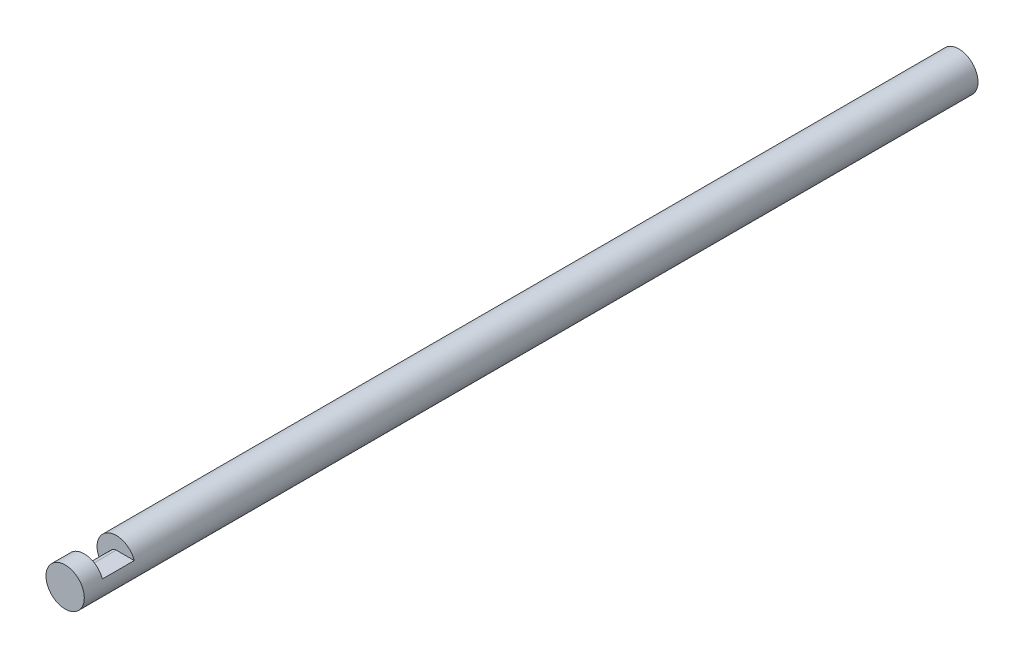
from build123d import *

# Parameters (mm, degrees)
SKETCH1_W          = 70
SKETCH1_H          = 1.5
CUT_EXTRUDE1_START = -4
CUT_EXTRUDE1_DEPTH = 2.5


with BuildPart() as part:
    # Sketch1 → Revolve1 (revolve)
    with BuildSketch(Plane(origin=(0, 0, 0), x_dir=(0, 0, -1), z_dir=(1, 0, 0))):
        with Locations((35, 0.75)):
            Rectangle(SKETCH1_W, SKETCH1_H)
    revolve(axis=Axis((0, 0, 9.840994653), (0, 0, -1)))

    # Sketch2 → Cut-Extrude1 (cut)
    with BuildSketch(Plane.XY.offset(CUT_EXTRUDE1_START)):
        with BuildLine():
            Line((0, 0.5), (1.414213562, 0.5))
            ThreePointArc((1.414213562, 0.5), (-1.060660172, 1.060660172), (-0.5, -1.414213562))
            Line((-0.5, -1.414213562), (-0.5, 0))
            ThreePointArc((-0.5, 0), (-0.353553391, 0.353553391), (0, 0.5))
        make_face()
    extrude(amount=CUT_EXTRUDE1_DEPTH, mode=Mode.SUBTRACT)


solid = part.part
